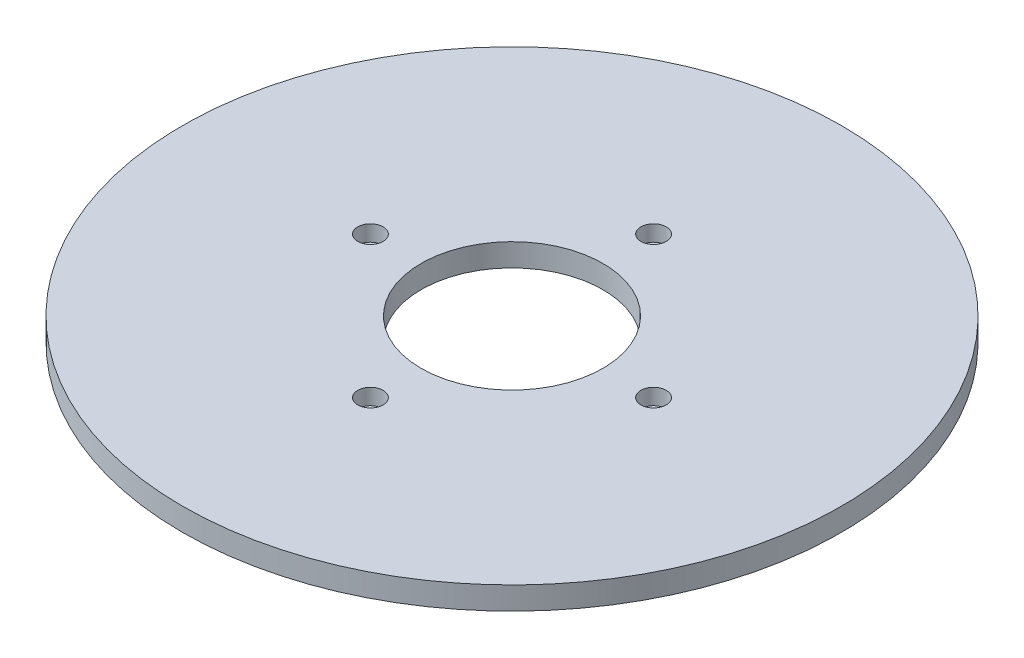
from build123d import *

# Parameters (mm, degrees)
SKETCH1_R           = 72.5
BOSS_EXTRUDE1_DEPTH = 5
SKETCH2_R           = 20
CUT_EXTRUDE1_DEPTH  = 103.652325838
SKETCH3_R           = 2.789705446
CUT_EXTRUDE2_DEPTH  = 3.513886262
CIRPATTERN1_COUNT   = 4


with BuildPart() as part:
    # Sketch1 → Boss-Extrude1 (new body)
    with BuildSketch(Plane(origin=(0, 0, 0), x_dir=(1, 0, 0), z_dir=(0, 1, 0))):
        Circle(SKETCH1_R)
    extrude(amount=BOSS_EXTRUDE1_DEPTH)

    # Sketch2 → Cut-Extrude1 (cut, through all)
    with BuildSketch(Plane(origin=(0, 0, 0), x_dir=(1, 0, 0), z_dir=(0, 1, 0))):
        Circle(SKETCH2_R)
    extrude(amount=CUT_EXTRUDE1_DEPTH, mode=Mode.SUBTRACT)

    # Sketch3 → Cut-Extrude2 (cut)
    with BuildSketch(Plane(origin=(0, 5, 0), x_dir=(1, 0, 0), z_dir=(0, 1, 0))):
        with Locations((-31.14497376, 0)):
            Circle(SKETCH3_R)
    cut_extrude2 = extrude(amount=-CUT_EXTRUDE2_DEPTH, mode=Mode.SUBTRACT)

    # CirPattern1: Cut-Extrude2 ×4 about axis
    cirpattern1_axis = Axis((0, 0, 0), (0, 1, 0))
    for i in range(1, CIRPATTERN1_COUNT):
        add(cut_extrude2.rotate(cirpattern1_axis, i * 360 / CIRPATTERN1_COUNT), mode=Mode.SUBTRACT)


solid = part.part
